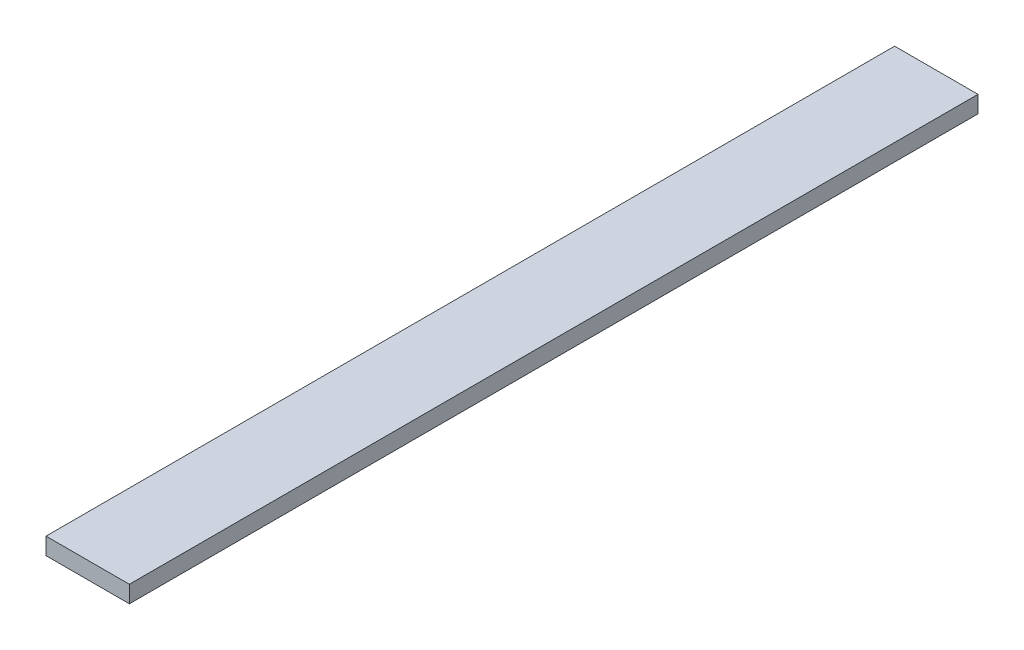
from build123d import *

# Parameters (mm, degrees)
SKETCH2_W           = 4.92
SKETCH2_H           = 50.08
BOSS_EXTRUDE1_DEPTH = 0.5


with BuildPart() as part:
    # Sketch2 → Boss-Extrude1 (new, symmetric)
    with BuildSketch(Plane(origin=(0, 0, 0), x_dir=(1, 0, 0), z_dir=(0, 1, 0))):
        Rectangle(SKETCH2_W, SKETCH2_H)
    extrude(amount=BOSS_EXTRUDE1_DEPTH, both=True)


solid = part.part
